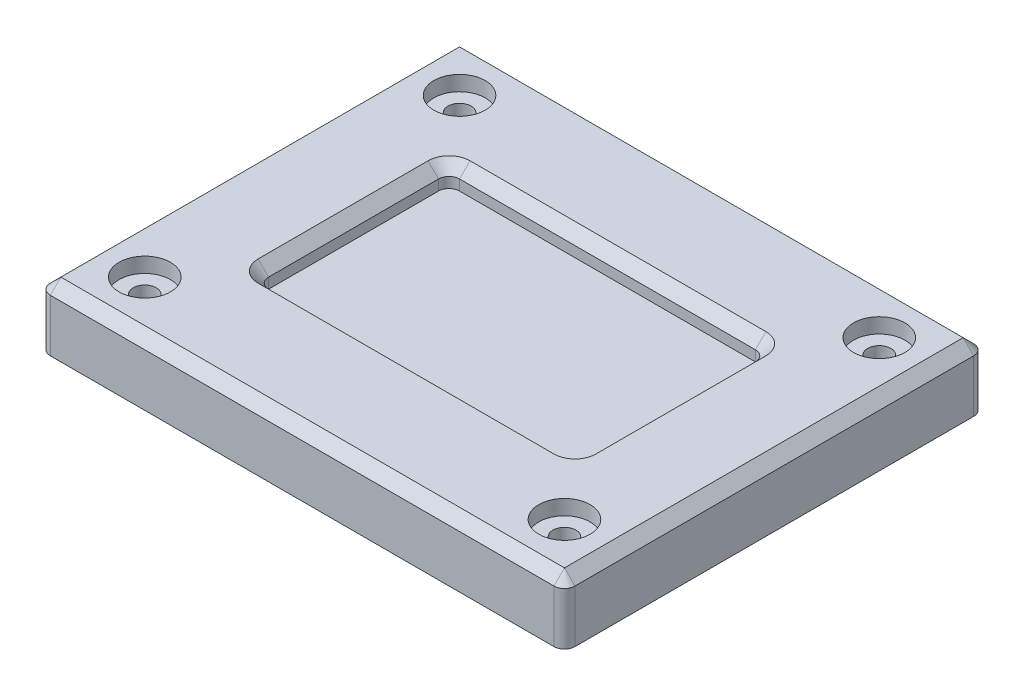
from build123d import *

# Parameters (mm, degrees)
SKETCH1_W                               = 125
SKETCH1_H                               = 100
BOSS_EXTRUDE1_DEPTH                     = 15
SKETCH2_W                               = 75.5
SKETCH2_H                               = 45.5
CUT_EXTRUDE1_DEPTH                      = 5
FILLET1_R                               = 2.5
CHAMFER2_SIZE                           = 2.5
CBORE_FOR_M5_HEX_HEAD_BOLT1_D           = 5.5
CBORE_FOR_M5_HEX_HEAD_BOLT1_CBORE_D     = 12.24
CBORE_FOR_M5_HEX_HEAD_BOLT1_CBORE_DEPTH = 3.58
LPATTERN2_COUNT                         = 2
LPATTERN2_PITCH                         = 75
LPATTERN2_COUNT_DIR2                    = 2
LPATTERN2_PITCH_DIR2                    = 100
FILLET2_R                               = 2.5
CHAMFER3_SIZE                           = 2.5


with BuildPart() as part:
    # Sketch1 → Boss-Extrude1 (new body)
    with BuildSketch(Plane(origin=(0, 0, 0), x_dir=(1, 0, 0), z_dir=(0, 1, 0))):
        Rectangle(SKETCH1_W, SKETCH1_H)
    extrude(amount=BOSS_EXTRUDE1_DEPTH)

    # Sketch2 → Cut-Extrude1 (cut)
    with BuildSketch(Plane(origin=(0, 15, 0), x_dir=(1, 0, 0), z_dir=(0, 1, 0))):
        Rectangle(SKETCH2_W, SKETCH2_H)
    extrude(amount=-CUT_EXTRUDE1_DEPTH, mode=Mode.SUBTRACT)

    # Fillet1
    fillet1_edges = [part.edges().sort_by_distance(p)[0] for p in [
        (37.75, 12.5, -22.75),
        (37.75, 12.5, 22.75),
        (-37.75, 12.5, 22.75),
        (-37.75, 12.5, -22.75),
    ]]
    fillet(fillet1_edges, radius=FILLET1_R)

    # Chamfer2
    chamfer2_edges = [part.edges().sort_by_distance(p)[0] for p in [
        (0, 15, 22.75),
        (-37.75, 15, 0),
        (37.75, 15, 0),
        (0, 15, -22.75),
        (-37.017766953, 15, 22.017766953),
        (37.017766953, 15, 22.017766953),
        (37.017766953, 15, -22.017766953),
        (-37.017766953, 15, -22.017766953),
    ]]
    chamfer(chamfer2_edges, length=CHAMFER2_SIZE)

    # CBORE for M5 Hex Head Bolt1 (through all)
    with Locations(Plane(origin=(0, 15, 0), x_dir=(1, 0, 0), z_dir=(0, 1, 0))):
        with Locations((50, 37.5)):
            cbore_for_m5_hex_head_bolt1 = CounterBoreHole(CBORE_FOR_M5_HEX_HEAD_BOLT1_D / 2, CBORE_FOR_M5_HEX_HEAD_BOLT1_CBORE_D / 2, CBORE_FOR_M5_HEX_HEAD_BOLT1_CBORE_DEPTH)

    # LPattern2: CBORE for M5 Hex Head Bolt1 2 × 2
    with Locations(*[(-j * LPATTERN2_PITCH_DIR2, 0, i * LPATTERN2_PITCH) for i in range(LPATTERN2_COUNT) for j in range(LPATTERN2_COUNT_DIR2) if (i, j) != (0, 0)]):
        add(cbore_for_m5_hex_head_bolt1, mode=Mode.SUBTRACT)

    # Fillet2
    fillet2_edges = [part.edges().sort_by_distance(p)[0] for p in [
        (62.5, 7.5, 50),
        (-62.5, 7.5, 50),
        (-62.5, 7.5, -50),
        (62.5, 7.5, -50),
    ]]
    fillet(fillet2_edges, radius=FILLET2_R)

    # Chamfer3
    chamfer3_edges = [part.edges().sort_by_distance(p)[0] for p in [
        (-62.5, 15, 0),
        (0, 15, -50),
        (62.5, 15, 0),
        (0, 15, 50),
        (-61.767766953, 15, 49.267766953),
        (61.767766953, 15, 49.267766953),
        (61.767766953, 15, -49.267766953),
        (-61.767766953, 15, -49.267766953),
    ]]
    chamfer(chamfer3_edges, length=CHAMFER3_SIZE - 0.0001)  # a hair under: the kernel refuses the full size


solid = part.part
